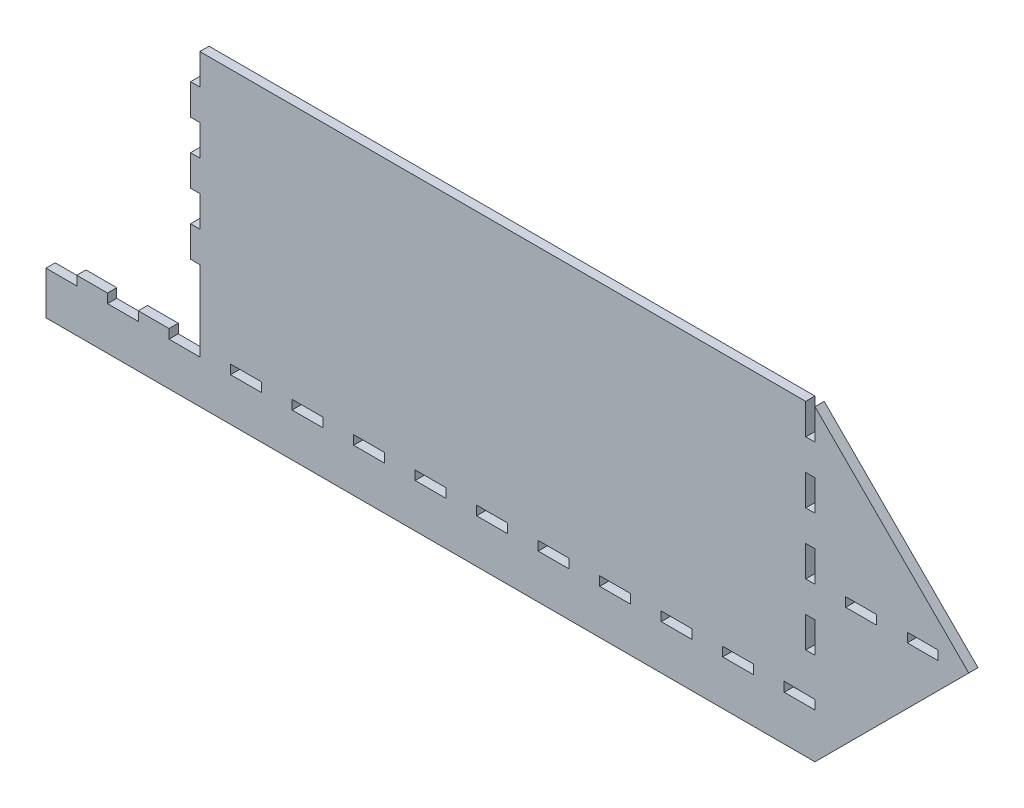
from build123d import *

# Parameters (mm, degrees)
SKETCH1_W           = 10
SKETCH1_H           = 3
SKETCH1_W_2         = 3
SKETCH1_H_2         = 10
BOSS_EXTRUDE1_DEPTH = 3


with BuildPart() as part:
    # Sketch1 → Boss-Extrude1 (new body)
    with BuildSketch(Plane.XY):
        Polygon((-112.631023813, -53.728350242), (-112.631023813, -67.728350242), (137.368976187, -67.728350242), (187.368976187, -17.728350242), (137.368976187, 32.271649758), (137.368976187, 22.271649758), (134.368976187, 22.271649758), (134.368976187, 32.271649758), (-62.631023813, 32.271649758), (-62.631023813, 22.271649758), (-65.631023813, 22.271649758), (-65.631023813, 12.271649758), (-62.631023813, 12.271649758), (-62.631023813, 2.271649758), (-65.631023813, 2.271649758), (-65.631023813, -7.728350242), (-62.631023813, -7.728350242), (-62.631023813, -17.728350242), (-65.631023813, -17.728350242), (-65.631023813, -27.728350242), (-62.631023813, -27.728350242), (-62.631023813, -50.728350242), (-62.631023813, -53.728350242), (-72.631023813, -53.728350242), (-72.631023813, -50.728350242), (-82.631023813, -50.728350242), (-82.631023813, -53.728350242), (-92.631023813, -53.728350242), (-92.631023813, -50.728350242), (-102.631023813, -50.728350242), (-102.631023813, -53.728350242), align=None)
        with Locations((-47.631023813, -52.228350242)):
            Rectangle(SKETCH1_W, SKETCH1_H, mode=Mode.SUBTRACT)
        with Locations((-27.631023813, -52.160370825)):
            Rectangle(SKETCH1_W, SKETCH1_H, mode=Mode.SUBTRACT)
        with Locations((-7.631023813, -52.092391408)):
            Rectangle(SKETCH1_W, SKETCH1_H, mode=Mode.SUBTRACT)
        with Locations((12.368976187, -52.024411991)):
            Rectangle(SKETCH1_W, SKETCH1_H, mode=Mode.SUBTRACT)
        with Locations((32.368976187, -51.956432574)):
            Rectangle(SKETCH1_W, SKETCH1_H, mode=Mode.SUBTRACT)
        with Locations((52.368976187, -51.888453158)):
            Rectangle(SKETCH1_W, SKETCH1_H, mode=Mode.SUBTRACT)
        with Locations((72.368976187, -51.820473741)):
            Rectangle(SKETCH1_W, SKETCH1_H, mode=Mode.SUBTRACT)
        with Locations((92.368976187, -51.752494324)):
            Rectangle(SKETCH1_W, SKETCH1_H, mode=Mode.SUBTRACT)
        with Locations((112.368976187, -51.684514907)):
            Rectangle(SKETCH1_W, SKETCH1_H, mode=Mode.SUBTRACT)
        Polygon((127.368976187, -50.012677607), (137.368976187, -50.168539286), (137.368976187, -53.135782362), (127.368976187, -53.135782362), align=None, mode=Mode.SUBTRACT)
        with Locations((135.868976187, -32.728350242)):
            Rectangle(SKETCH1_W_2, SKETCH1_H_2, mode=Mode.SUBTRACT)
        with Locations((135.868976187, -12.728350242)):
            Rectangle(SKETCH1_W_2, SKETCH1_H_2, mode=Mode.SUBTRACT)
        with Locations((152.368976187, -17.728350242)):
            Rectangle(SKETCH1_W, SKETCH1_H, mode=Mode.SUBTRACT)
        with Locations((172.368976187, -17.728350242)):
            Rectangle(SKETCH1_W, SKETCH1_H, mode=Mode.SUBTRACT)
        with Locations((135.868976187, 7.271649758)):
            Rectangle(SKETCH1_W_2, SKETCH1_H_2, mode=Mode.SUBTRACT)
    extrude(amount=BOSS_EXTRUDE1_DEPTH)


solid = part.part
